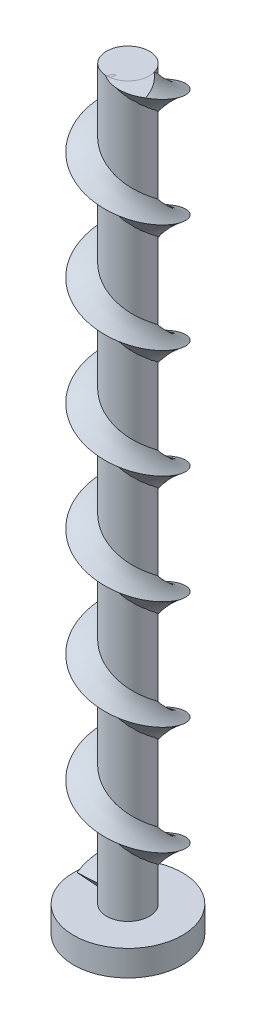
from build123d import *

# Parameters (mm, degrees)
SKETCH1_R           = 12.7
SKETCH1_W           = 5
SKETCH1_H           = 3
BOSS_EXTRUDE1_DEPTH = 6
SKETCH2_R           = 5
BOSS_EXTRUDE2_DEPTH = 170
SWEEP1_PITCH        = 25.4
SWEEP1_HEIGHT       = 172.72
SWEEP1_RADIUS       = 5
SWEEP1_START_ANGLE  = -90
SKETCH5_R           = 43.501235113
CUT_EXTRUDE1_DEPTH  = 177.914046927


with BuildPart() as part:
    # Sketch1 → Boss-Extrude1 (new body)
    with BuildSketch(Plane(origin=(0, 0, 0), x_dir=(1, 0, 0), z_dir=(0, 1, 0))):
        with Locations(Location((0, 0, 0), (0, 0, 270))):
            Circle(SKETCH1_R)
        Rectangle(SKETCH1_W, SKETCH1_H, mode=Mode.SUBTRACT)
    extrude(amount=BOSS_EXTRUDE1_DEPTH)

    # Sketch2 → Boss-Extrude2 (add)
    with BuildSketch(Plane(origin=(0, 6, 0), x_dir=(1, 0, 0), z_dir=(0, 1, 0))):
        with Locations(Location((0, 0, 0), (0, 0, 270))):
            Circle(SKETCH2_R)
    extrude(amount=BOSS_EXTRUDE2_DEPTH)


with BuildPart() as body_2:
    # Sweep1: sweep along a helix
    with BuildLine() as sweep1_path:
        add(Helix(SWEEP1_PITCH, SWEEP1_HEIGHT, SWEEP1_RADIUS, center=(0, 6, 0), direction=(0, 1, 0), lefthand=True, mode=Mode.PRIVATE).rotate(Axis((0, 6, 0), (0, 1, 0)), SWEEP1_START_ANGLE))
    # Sketch4 → Sweep1 (sweep)
    with BuildSketch(Plane(origin=(-5, 6, 0), x_dir=(-1, 0, 0), z_dir=(-8.208518628057765e-15, 0.6287204907193026, -0.7776313680335172))):
        Polygon((-1.081452651, 4.568316744), (-1.081452651, -2.059475138), (5.118547349, 2.80435916), align=None)
    sweep(path=sweep1_path.line, is_frenet=True)

    # Sketch5 → Cut-Extrude1 (cut, through all)
    with BuildSketch(Plane(origin=(0, 176, 0), x_dir=(1, 0, 0), z_dir=(0, 1, 0))):
        Circle(SKETCH5_R)
    extrude(amount=CUT_EXTRUDE1_DEPTH, mode=Mode.SUBTRACT)


solid = Compound([part.part, body_2.part])
